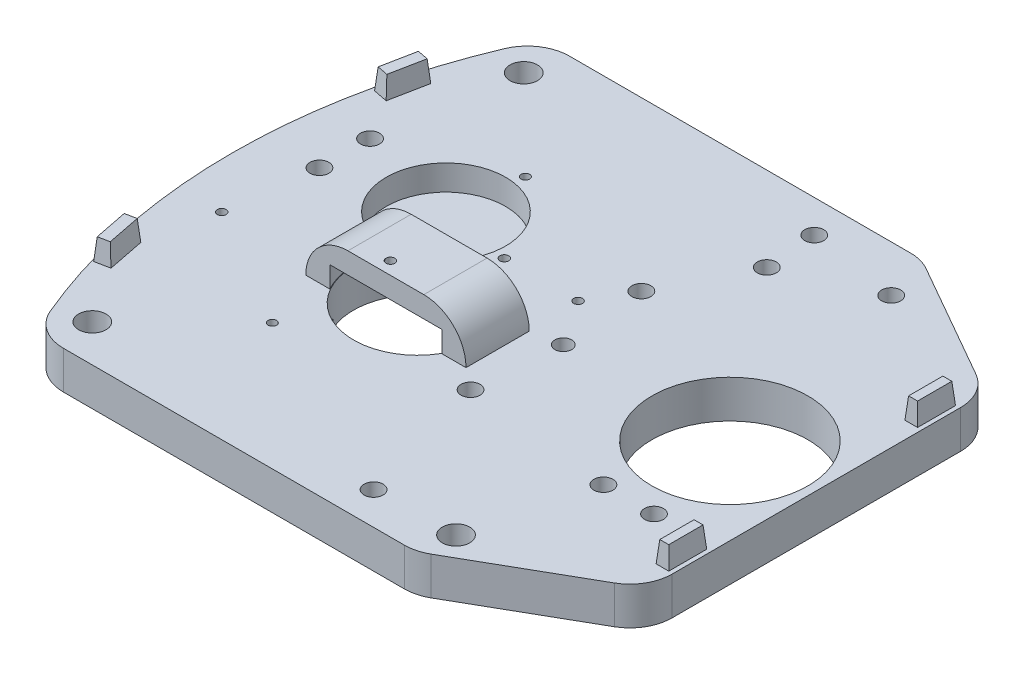
from build123d import *

# Parameters (mm, degrees)
SKETCH1_W                         = 125
SKETCH1_H                         = 120
TOP_BASE_DEPTH                    = 9
SKETCH5_R                         = 14.15
DRIVE_GEAR_HOLE_DEPTH             = 6
SKETCH28_R                        = 15.15
TWO_STAGE_GEAR_HOLE_DEPTH         = 174.51080658
SKETCH8_R                         = 18.5
XL320_FINGER_KNUCKLE_MOUNT_DEPTH  = 174.51080658
SKETCH26_R                        = 1
STRING_HOLES_DEPTH                = 174.51080658
XL320_MOUNT_HOLES_R               = 2.25
XL320_MOUNT_HOLES_M4_DEPTH        = 174.51080658
AX12_MOUNT_HOLES_R                = 2.25
AX12_MOUNT_HOLES_M4_DEPTH         = 174.51080658
NUTS_M4_DEPTH                     = 5
SKETCH34_R                        = 15
HOLES_FOR_M4_IN_FINGER_GEAR_DEPTH = 2
SKETCH31_W                        = 38
SKETCH31_H                        = 15
BOSS_EXTRUDE1_DEPTH               = 10
SKETCH32_R                        = 15.25
CUT_EXTRUDE5_DEPTH                = 5
SKETCH33_R                        = 1
CUT_EXTRUDE6_DEPTH                = 2.5
FILLET2_R                         = 10
CUT_EXTRUDE8_DEPTH                = 174.565549577
FILLET4_R                         = 10
SKETCH37_R                        = 3.25
CONNECT_HOLES_M6_DEPTH            = 10
SKETCH41_R                        = 2
CONNECT_TO_HOUSE_M4_DEPTH         = 174.565549577
SKETCH42_W                        = 3
SKETCH42_H                        = 9
HOUSING_FITS_DEPTH                = 5
HOUSING_FITS_DRAFT                = 5
HOUSING_FITS_PROFILE_2_DEPTH      = 5
HOUSING_FITS_PROFILE_2_DRAFT      = 5
HOUSING_FITS_PROFILE_3_DEPTH      = 5
HOUSING_FITS_PROFILE_3_DRAFT      = 5
HOUSING_FITS_PROFILE_4_DEPTH      = 5
HOUSING_FITS_PROFILE_4_DRAFT      = 5
SKETCH43_R                        = 1
M2_SHAFT_HOLE_DEPTH               = 2
SKETCH44_R                        = 1.05
CUT_EXTRUDE9_DEPTH                = 5
SKETCH45_R                        = 1.05
CUT_EXTRUDE10_DEPTH               = 2.5


with BuildPart() as part:
    # Sketch1 → Top_Base (new body)
    with BuildSketch(Plane(origin=(0, 0, 0), x_dir=(1, 0, 0), z_dir=(0, 1, 0))):
        with BuildLine():
            ThreePointArc((0, 120), (-13.654246239, 60), (0, 0))
            Line((0, 0), (0, 120))
        make_face()
        with Locations((62.5, 60)):
            Rectangle(SKETCH1_W, SKETCH1_H)
    extrude(amount=TOP_BASE_DEPTH)

    # Sketch5 → Drive_Gear_Hole (cut)
    with BuildSketch(Plane(origin=(0, 9, 0), x_dir=(1, 0, 0), z_dir=(0, 1, 0))):
        with Locations(Location((23.75, 73.41386581, 0), (0, 0, 270))):
            Circle(SKETCH5_R)
    extrude(amount=-DRIVE_GEAR_HOLE_DEPTH, mode=Mode.SUBTRACT)

    # Sketch28 → Two_Stage_Gear_Hole (cut, through all)
    with BuildSketch(Plane(origin=(0, 9, 0), x_dir=(1, 0, 0), z_dir=(0, 1, 0))):
        with Locations(Location((39.169567191, 51.25, 0), (0, 0, 270))):
            Circle(SKETCH28_R)
    extrude(amount=-TWO_STAGE_GEAR_HOLE_DEPTH, mode=Mode.SUBTRACT)

    # Sketch8 → XL320_Finger_Knuckle_Mount (cut, through all)
    with BuildSketch(Plane(origin=(0, 9, 0), x_dir=(1, 0, 0), z_dir=(0, 1, 0))):
        with Locations(Location((104.5, 60, 0), (0, 0, 270))):
            Circle(SKETCH8_R)
    extrude(amount=-XL320_FINGER_KNUCKLE_MOUNT_DEPTH, mode=Mode.SUBTRACT)

    # Sketch26 → String_Holes (cut, through all)
    with BuildSketch(Plane.XZ.offset(-9)):
        with Locations(Location((26, -30, 0), (0, 0, 270))):
            Circle(SKETCH26_R)
        with Locations(Location((26, -90, 0), (0, 0, 90))):
            Circle(SKETCH26_R)
    extrude(amount=STRING_HOLES_DEPTH, mode=Mode.SUBTRACT)

    # XL320_Mount_Holes → XL320_Mount_Holes_(M4) (cut, through all)
    with BuildSketch(Plane(origin=(0, 9, 0), x_dir=(1, 0, 0), z_dir=(0, 1, 0))):
        with Locations(Location((110.5, 36, 0), (0, 0, 270))):
            Circle(XL320_MOUNT_HOLES_R)
        with Locations(Location((98.5, 36, 0), (0, 0, 270))):
            Circle(XL320_MOUNT_HOLES_R)
        with Locations(Location((-0.25, 79.41386581, 0), (0, 0, 270))):
            Circle(XL320_MOUNT_HOLES_R)
        with Locations(Location((-0.25, 67.41386581, 0), (0, 0, 270))):
            Circle(XL320_MOUNT_HOLES_R)
    extrude(amount=-XL320_MOUNT_HOLES_M4_DEPTH, mode=Mode.SUBTRACT)

    # AX12_Mount_Holes → AX12_Mount_Holes_(M4) (cut, through all)
    with BuildSketch(Plane(origin=(0, 9, 0), x_dir=(1, 0, 0), z_dir=(0, 1, 0))):
        with Locations(Location((72.25, 112.25, 0), (0, 0, 270))):
            Circle(AX12_MOUNT_HOLES_R)
        with Locations(Location((63.25, 80.25, 0), (0, 0, 270))):
            Circle(AX12_MOUNT_HOLES_R)
        with Locations(Location((73.25, 100, 0), (0, 0, 270))):
            Circle(AX12_MOUNT_HOLES_R)
        with Locations(Location((93.75, 109, 0), (0, 0, 270))):
            Circle(AX12_MOUNT_HOLES_R)
        with Locations(Location((63.25, 39.75, 0), (0, 0, 270))):
            Circle(AX12_MOUNT_HOLES_R)
        with Locations(Location((72.25, 7.75, 0), (0, 0, 270))):
            Circle(AX12_MOUNT_HOLES_R)
    extrude(amount=-AX12_MOUNT_HOLES_M4_DEPTH, mode=Mode.SUBTRACT)

    # Sketch27 → Nuts_(M4) (cut)
    with BuildSketch(Plane.XZ):
        Polygon((110.5, -31.958548116), (107, -33.979274058), (107, -38.020725942), (110.5, -40.041451884), (114, -38.020725942), (114, -33.979274058), align=None)
        Polygon((98.5, -31.958548116), (95, -33.979274058), (95, -38.020725942), (98.5, -40.041451884), (102, -38.020725942), (102, -33.979274058), align=None)
        Polygon((3.25, -65.393139868), (-0.25, -63.372413926), (-3.75, -65.393139868), (-3.75, -69.434591752), (-0.25, -71.455317694), (3.25, -69.434591752), align=None)
        Polygon((-3.75, -77.393139868), (-3.75, -81.434591752), (-0.25, -83.455317694), (3.25, -81.434591752), (3.25, -77.393139868), (-0.25, -75.372413926), align=None)
    extrude(amount=-NUTS_M4_DEPTH, mode=Mode.SUBTRACT)

    # Sketch34 → Holes_For_M4_In_Finger_Gear (cut)
    with BuildSketch(Plane.XZ):
        with Locations((26, -30)):
            Circle(SKETCH34_R)
        with Locations(Location((26, -90, 0), (0, 0, 270))):
            Circle(SKETCH34_R)
    extrude(amount=-HOLES_FOR_M4_IN_FINGER_GEAR_DEPTH, mode=Mode.SUBTRACT)

    # Sketch31 → Boss-Extrude1 (add)
    with BuildSketch(Plane(origin=(0, 9, 0), x_dir=(1, 0, 0), z_dir=(0, 1, 0))):
        with Locations((39.169567191, 51.25)):
            Rectangle(SKETCH31_W, SKETCH31_H)
    extrude(amount=BOSS_EXTRUDE1_DEPTH)

    # Sketch32 → Cut-Extrude5 (cut)
    with BuildSketch(Plane.XZ.offset(-9)):
        with Locations((39.169567191, -51.25)):
            Circle(SKETCH32_R)
    extrude(amount=-CUT_EXTRUDE5_DEPTH, mode=Mode.SUBTRACT)

    # Sketch33 → Cut-Extrude6 (cut)
    with BuildSketch(Plane.XZ.offset(-14)):
        with Locations(Location((39.169567191, -51.25, 0), (0, 0, 270))):
            Circle(SKETCH33_R)
    extrude(amount=-CUT_EXTRUDE6_DEPTH, mode=Mode.SUBTRACT)

    # Fillet2
    fillet2_edges = [part.edges().sort_by_distance(p)[0] for p in [
        (58.169567191, 19, -51.25),
        (20.169567191, 19, -51.25),
    ]]
    fillet(fillet2_edges, radius=FILLET2_R - 0.0001)  # a hair under: the kernel refuses the full size

    # Sketch36 → Cut-Extrude8 (cut, through all)
    with BuildSketch(Plane(origin=(0, 9, 0), x_dir=(1, 0, 0), z_dir=(0, 1, 0))):
        Polygon((90, 120), (125, 100), (125, 120), align=None)
        Polygon((125, 0), (90, 0), (125, 20), align=None)
    extrude(amount=-CUT_EXTRUDE8_DEPTH, mode=Mode.SUBTRACT)

    # Fillet4
    fillet4_edges = [part.edges().sort_by_distance(p)[0] for p in [
        (90, 4.5, -120),
        (125, 4.5, -100),
        (125, 4.5, -20),
        (90, 4.5, 0),
        (0, 4.5, -120),
        (0, 4.5, 0),
    ]]
    fillet(fillet4_edges, radius=FILLET4_R)

    # Sketch37 → Connect_Holes_(M6) (cut)
    with BuildSketch(Plane(origin=(0, 9, 0), x_dir=(1, 0, 0), z_dir=(0, 1, 0))):
        with Locations(Location((4.459226107, 111.152938298, 0), (0, 0, 270))):
            Circle(SKETCH37_R)
        with Locations(Location((4.459226107, 8.847061702, 0), (0, 0, 270))):
            Circle(SKETCH37_R)
        with Locations(Location((91.344355629, 8.205555711, 0), (0, 0, 270))):
            Circle(SKETCH37_R)
    extrude(amount=-CONNECT_HOLES_M6_DEPTH, mode=Mode.SUBTRACT)

    # Sketch41 → Connect_To_House_(M4) (cut, through all)
    with BuildSketch(Plane(origin=(0, 9, 0), x_dir=(1, 0, 0), z_dir=(0, 1, 0))):
        with Locations(Location((65, 60, 0), (0, 0, 270))):
            Circle(SKETCH41_R)
    extrude(amount=-CONNECT_TO_HOUSE_M4_DEPTH, mode=Mode.SUBTRACT)


with BuildPart() as housing_fits_tool:
    # Sketch42 → Housing_Fits (with draft: the straight prism first)
    with BuildSketch(Plane(origin=(0, 9, 0), x_dir=(1, 0, 0), z_dir=(0, 1, 0))):
        with Locations((122.5, 30.5)):
            Rectangle(SKETCH42_W, SKETCH42_H)
    extrude(amount=HOUSING_FITS_DEPTH)
    # Housing_Fits: the draft: its side faces are tilted about the plane it starts from
    housing_fits_sides = [housing_fits_tool.faces().sort_by_distance(p)[0] for p in [
        (124, 11.5, -30.5),
        (122.5, 11.5, -35),
        (121, 11.5, -30.5),
        (122.5, 11.5, -26),
    ]]
    draft(housing_fits_sides, Plane(origin=(0, 9, 0), x_dir=(1, 0, 0), z_dir=(0, 1, 0)), HOUSING_FITS_DRAFT)


with BuildPart() as part_1:
    add(part.part)

    # Housing_Fits: add housing_fits_tool
    add(housing_fits_tool.part)


with BuildPart() as housing_fits_profile_2_tool:
    # Sketch42 → Housing_Fits profile 2 (with draft: the straight prism first)
    with BuildSketch(Plane(origin=(0, 9, 0), x_dir=(1, 0, 0), z_dir=(0, 1, 0))):
        Polygon((-9.533377338, 30.232888291), (-7.782151246, 21.404909633), (-4.349048435, 22.085942002), (-6.100274527, 30.91392066), align=None)
    extrude(amount=HOUSING_FITS_PROFILE_2_DEPTH)
    # Housing_Fits profile 2: the draft: its side faces are tilted about the plane it starts from
    housing_fits_profile_2_sides = [housing_fits_profile_2_tool.faces().sort_by_distance(p)[0] for p in [
        (-8.657764292, 11.5, -25.818898962),
        (-6.065599841, 11.5, -21.745425818),
        (-5.224661481, 11.5, -26.499931331),
        (-7.816825933, 11.5, -30.573404475),
    ]]
    draft(housing_fits_profile_2_sides, Plane(origin=(0, 9, 0), x_dir=(1, 0, 0), z_dir=(0, 1, 0)), HOUSING_FITS_PROFILE_2_DRAFT)


with BuildPart() as part_2:
    add(part_1.part)

    # Housing_Fits profile 2: add housing_fits_profile_2_tool
    add(housing_fits_profile_2_tool.part)


with BuildPart() as housing_fits_profile_3_tool:
    # Sketch42 → Housing_Fits profile 3 (with draft: the straight prism first)
    with BuildSketch(Plane(origin=(0, 9, 0), x_dir=(1, 0, 0), z_dir=(0, 1, 0))):
        Polygon((-4.349048435, 97.914057998), (-7.782151246, 98.595090367), (-9.533377338, 89.767111709), (-6.100274527, 89.08607934), align=None)
    extrude(amount=HOUSING_FITS_PROFILE_3_DEPTH)
    # Housing_Fits profile 3: the draft: its side faces are tilted about the plane it starts from
    housing_fits_profile_3_sides = [housing_fits_profile_3_tool.faces().sort_by_distance(p)[0] for p in [
        (-6.065599841, 11.5, -98.254574182),
        (-8.657764292, 11.5, -94.181101038),
        (-7.816825933, 11.5, -89.426595525),
        (-5.224661481, 11.5, -93.500068669),
    ]]
    draft(housing_fits_profile_3_sides, Plane(origin=(0, 9, 0), x_dir=(1, 0, 0), z_dir=(0, 1, 0)), HOUSING_FITS_PROFILE_3_DRAFT)


with BuildPart() as part_3:
    add(part_2.part)

    # Housing_Fits profile 3: add housing_fits_profile_3_tool
    add(housing_fits_profile_3_tool.part)


with BuildPart() as housing_fits_profile_4_tool:
    # Sketch42 → Housing_Fits profile 4 (with draft: the straight prism first)
    with BuildSketch(Plane(origin=(0, 9, 0), x_dir=(1, 0, 0), z_dir=(0, 1, 0))):
        with Locations((122.5, 89.5)):
            Rectangle(SKETCH42_W, SKETCH42_H)
    extrude(amount=HOUSING_FITS_PROFILE_4_DEPTH)
    # Housing_Fits profile 4: the draft: its side faces are tilted about the plane it starts from
    housing_fits_profile_4_sides = [housing_fits_profile_4_tool.faces().sort_by_distance(p)[0] for p in [
        (122.5, 11.5, -94),
        (121, 11.5, -89.5),
        (122.5, 11.5, -85),
        (124, 11.5, -89.5),
    ]]
    draft(housing_fits_profile_4_sides, Plane(origin=(0, 9, 0), x_dir=(1, 0, 0), z_dir=(0, 1, 0)), HOUSING_FITS_PROFILE_4_DRAFT)


with BuildPart() as part_4:
    add(part_3.part)

    # Housing_Fits profile 4: add housing_fits_profile_4_tool
    add(housing_fits_profile_4_tool.part)

    # Sketch43 → M2_Shaft_Hole (cut)
    with BuildSketch(Plane.XZ):
        with Locations(Location((39.169567191, -68.75, 0), (0, 0, 270))):
            Circle(SKETCH43_R)
    extrude(amount=-M2_SHAFT_HOLE_DEPTH, mode=Mode.SUBTRACT)

    # Sketch44 → Cut-Extrude9 (cut)
    with BuildSketch(Plane(origin=(0, 9, 0), x_dir=(1, 0, 0), z_dir=(0, 1, 0))):
        with Locations(Location((-2.75, 46.75, 0), (0, 0, 270))):
            Circle(SKETCH44_R)
        with Locations(Location((40.25, 70.75, 0), (0, 0, 270))):
            Circle(SKETCH44_R)
        with Locations(Location((57.75, 70.75, 0), (0, 0, 270))):
            Circle(SKETCH44_R)
    extrude(amount=-CUT_EXTRUDE9_DEPTH, mode=Mode.SUBTRACT)

    # Sketch45 → Cut-Extrude10 (cut)
    with BuildSketch(Plane(origin=(0, 19, 0), x_dir=(1, 0, 0), z_dir=(0, 1, 0))):
        with Locations(Location((37.25, 46.75, 0), (0, 0, 270))):
            Circle(SKETCH45_R)
    extrude(amount=-CUT_EXTRUDE10_DEPTH, mode=Mode.SUBTRACT)


solid = part_4.part
